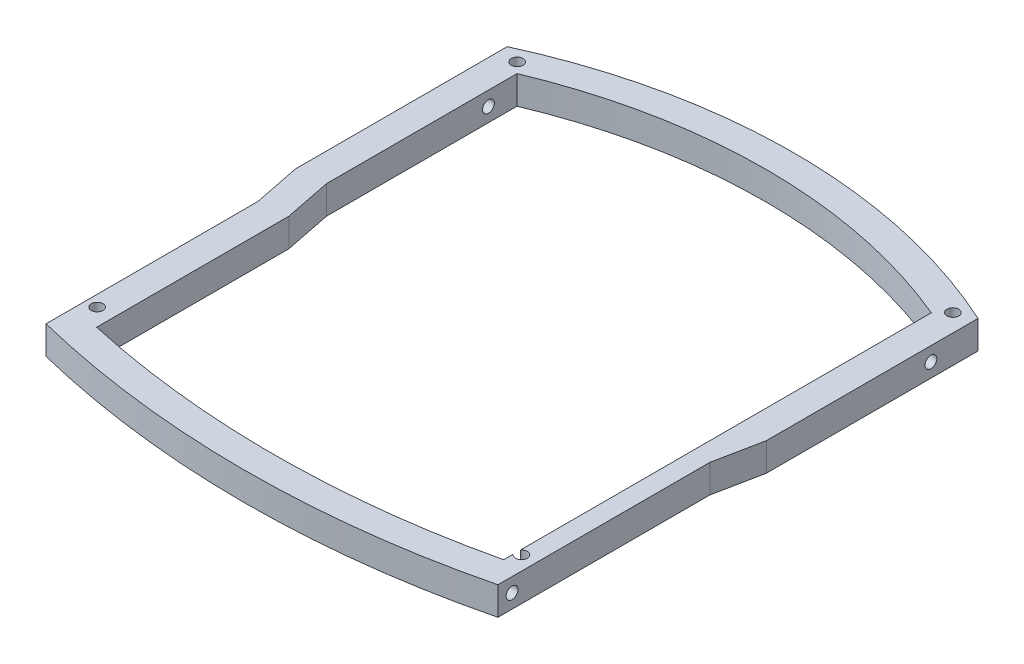
from build123d import *

# Parameters (mm, degrees)
BOSS_EXTRUDE1_DEPTH              = 6
TAP_DRILL_FOR_M3_TAP1_AT_2_COUNT = 2
TAP_DRILL_FOR_M3_TAP1_AT_2_PITCH = 86.979998
CUT_EXTRUDE1_REACH               = 81.019
TAP_DRILL_FOR_M3_TAP2_D          = 2.5
TAP_DRILL_FOR_M3_TAP2_DEPTH      = 10
TAP_DRILL_FOR_M3_TAP2_TIP        = 0.751075774


with BuildPart() as part:
    # Sketch1 → Boss-Extrude1 (new body)
    with BuildSketch(Plane(origin=(0, 0, 0), x_dir=(1, 0, 0), z_dir=(0, 1, 0))):
        with BuildLine():
            Line((-50, 5), (-50, 49.979998))
            ThreePointArc((-50, 49.979998), (0, 60.892876853), (50, 49.979998))
            Line((50, 49.979998), (50, 5))
            Line((50, 5), (48, -5))
            Line((48, -5), (48, -50))
            ThreePointArc((48, -50), (0, -55.845422408), (-48, -50))
            Line((-48, -50), (-48, -5))
            Line((-48, -5), (-50, 5))
        make_face()
        with BuildLine():
            Line((-44, 5.594117082), (-44, 46.059411454))
            ThreePointArc((-44, 46.059411454), (0, 54.892876853), (44, 46.059411454))
            Line((44, 46.059411454), (44, 5.594117082))
            Line((44, 5.594117082), (42, -4.405882918))
            Line((42, -4.405882918), (42, -45.244472036))
            ThreePointArc((42, -45.244472036), (0, -49.845422408), (-42, -45.244472036))
            Line((-42, -45.244472036), (-42, -4.405882918))
            Line((-42, -4.405882918), (-44, 5.594117082))
        make_face(mode=Mode.SUBTRACT)
    extrude(amount=BOSS_EXTRUDE1_DEPTH)

    # Sketch2 → Tap Drill for M3 Tap1 (revolve, cut)
    with BuildSketch(Plane(origin=(50, 3, 47), x_dir=(0, 0, -1), z_dir=(0, 1, 0))):
        Polygon((0, 0), (0, 10.751075774), (1.25, 10), (1.25, 0), align=None)
    tap_drill_for_m3_tap1 = revolve(axis=Axis((56.35, 3, 47), (-1, 0, 0)), mode=Mode.SUBTRACT)

    # Tap Drill for M3 Tap1 at 2: Tap Drill for M3 Tap1 ×2
    with Locations(*[(0, 0, -i * TAP_DRILL_FOR_M3_TAP1_AT_2_PITCH) for i in range(1, TAP_DRILL_FOR_M3_TAP1_AT_2_COUNT)]):
        add(tap_drill_for_m3_tap1, mode=Mode.SUBTRACT)

    # Sketch4 → Cut-Extrude1 (cut, up to next)
    with BuildSketch(Plane(origin=(0, 6, 0), x_dir=(1, 0, 0), z_dir=(0, 1, 0)), mode=Mode.PRIVATE) as cut_extrude1_sk1:
        with BuildLine():
            Line((44, 5.594117082), (44, -44.789858685))
            ThreePointArc((44, -44.789858685), (43.00060079, -45.019808443), (42, -45.244472036))
            Line((42, -45.244472036), (42, -4.405882918))
            Line((42, -4.405882918), (44, 5.594117082))
        make_face()
    cut_extrude1_tool1 = extrude(cut_extrude1_sk1.sketch, amount=-CUT_EXTRUDE1_REACH, mode=Mode.PRIVATE) & part.part
    add(cut_extrude1_tool1.solids().sort_by_distance((43.034878, 6, 22.121292))[0], mode=Mode.SUBTRACT)

    # Mirror3: Tap Drill for M3 Tap1 across plane
    add(tap_drill_for_m3_tap1.mirror(Plane(origin=(0, 0, 0), x_dir=(0, 0, 1), z_dir=(1, 0, 0))), mode=Mode.SUBTRACT)

    # Mirror3 copy 1 sketch → Mirror3 copy 1 (revolve, cut)
    with BuildSketch(Plane(origin=(-50, 3, -39.979998), x_dir=(0, 0, -1), z_dir=(0, 1, 0))):
        Polygon((0, 0), (0, -10.751075774), (1.25, -10), (1.25, 0), align=None)
    revolve(axis=Axis((-56.35, 3, -39.979998), (-1, 0, 0)), mode=Mode.SUBTRACT)

    # Tap Drill for M3 Tap2
    with Locations(Plane(origin=(0, 6, 0), x_dir=(1, 0, 0), z_dir=(0, 1, 0))):
        with Locations((45, -42), (-45.65, -41.5), (-46.15, 48.229998), (46.25, 48.399998)):
            Hole(TAP_DRILL_FOR_M3_TAP2_D / 2, depth=TAP_DRILL_FOR_M3_TAP2_DEPTH)
            with Locations((0, 0, -(TAP_DRILL_FOR_M3_TAP2_DEPTH + TAP_DRILL_FOR_M3_TAP2_TIP / 2))):  # 118° drill point
                Cone(0, TAP_DRILL_FOR_M3_TAP2_D / 2, TAP_DRILL_FOR_M3_TAP2_TIP, mode=Mode.SUBTRACT)


solid = part.part
